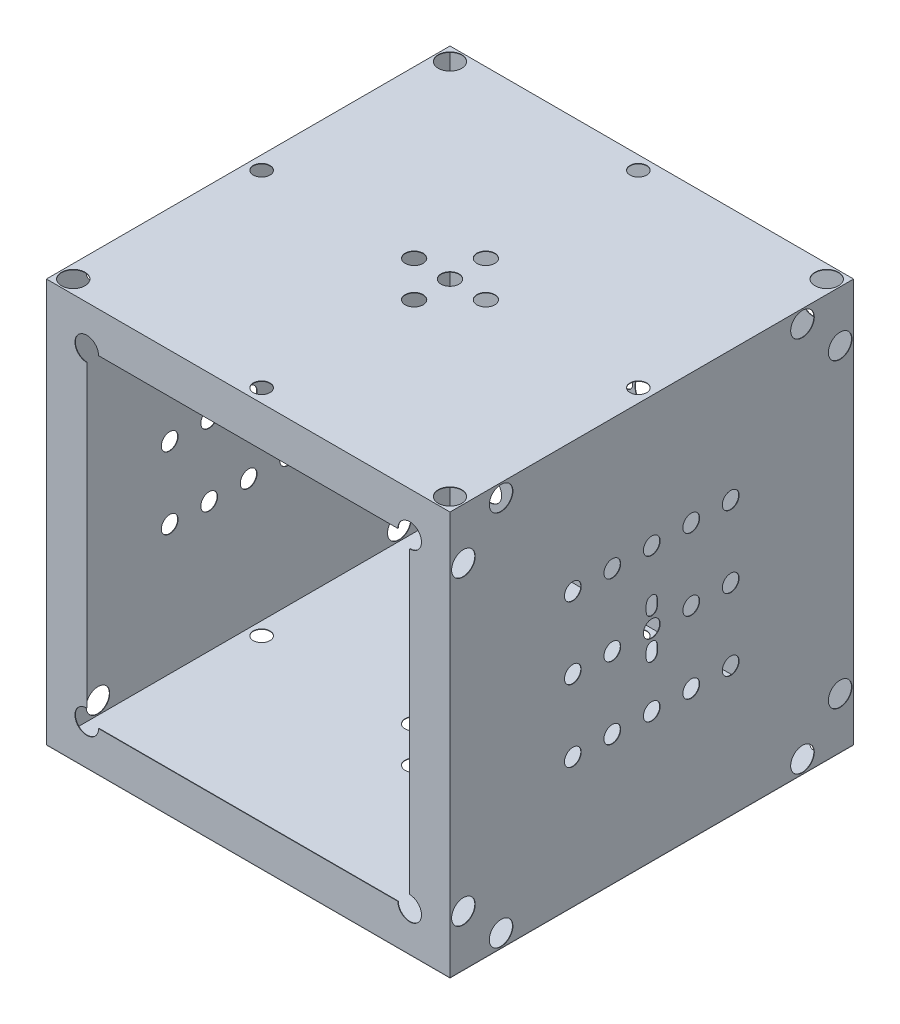
from build123d import *

# Parameters (mm, degrees)
SKETCH1_W           = 2249.6
SKETCH1_H           = 2249.6
BOSS_EXTRUDE1_DEPTH = 2249.6
SHELL1_T            = -2.4
SKETCH2_W           = 2249.6
SKETCH2_H           = 2249.6
SKETCH2_W_2         = 1800
SKETCH2_H_2         = 1800
BOSS_EXTRUDE3_DEPTH = 2.4
SKETCH3_R           = 49.85
SKETCH3_R_2         = 46.75
SKETCH3_R_3         = 65.8
CUT_EXTRUDE1_DEPTH  = 2756.186062683
SKETCH4_R           = 46.75
SKETCH4_R_2         = 65.8
CUT_EXTRUDE2_DEPTH  = 3375.4
SKETCH5_R           = 91.2
SKETCH5_R_2         = 35.635
SKETCH5_R_3         = 65.8
CUT_EXTRUDE3_DEPTH  = 3375.4


with BuildPart() as part:
    # Sketch1 → Boss-Extrude1 (new body)
    with BuildSketch(Plane(origin=(0, 0, 0), x_dir=(1, 0, 0), z_dir=(0, 1, 0))):
        Rectangle(SKETCH1_W, SKETCH1_H)
    extrude(amount=BOSS_EXTRUDE1_DEPTH)

    # Shell1
    shell1_openings = [part.faces().sort_by_distance(p)[0] for p in [
        (0, 1124.8, 1124.8),
    ]]
    offset(amount=SHELL1_T, openings=shell1_openings, kind=Kind.INTERSECTION)

    # Sketch2 → Boss-Extrude3 (add)
    with BuildSketch(Plane.XY.offset(1124.8)):
        with Locations((0, 1124.8)):
            Rectangle(SKETCH2_W, SKETCH2_H)
        with Locations((0, 1124.8)):
            Rectangle(SKETCH2_W_2, SKETCH2_H_2, mode=Mode.SUBTRACT)
    extrude(amount=-BOSS_EXTRUDE3_DEPTH)

    # Sketch3 → Cut-Extrude1 (cut, through all)
    with BuildSketch(Plane(origin=(0, 2249.6, 0), x_dir=(1, 0, 0), z_dir=(0, 1, 0))):
        Circle(SKETCH3_R)
        with Locations((-200, 0)):
            Circle(SKETCH3_R)
        with Locations((-1050, 0)):
            Circle(SKETCH3_R_2)
        with Locations((-1050, 1050)):
            Circle(SKETCH3_R_3)
        with Locations((1050, 1050)):
            Circle(SKETCH3_R_3)
        with Locations((200, 0)):
            Circle(SKETCH3_R)
        with Locations((1050, 0)):
            Circle(SKETCH3_R_2)
        with Locations((-1050, -1050)):
            Circle(SKETCH3_R_3)
        with Locations((0, -1050)):
            Circle(SKETCH3_R_2)
        with Locations((0, -200)):
            Circle(SKETCH3_R)
        with Locations((0, 200)):
            Circle(SKETCH3_R)
        with Locations((0, 1050)):
            Circle(SKETCH3_R_2)
        with Locations((1050, -1050)):
            Circle(SKETCH3_R_3)
    extrude(amount=-CUT_EXTRUDE1_DEPTH, mode=Mode.SUBTRACT)

    # Sketch4 → Cut-Extrude2 (cut, through all)
    with BuildSketch(Plane.ZY.offset(1124.8)):
        with Locations((0, 1124.8)):
            Circle(SKETCH4_R)
        with Locations((-220, 1124.8)):
            Circle(SKETCH4_R)
        with Locations((-440, 1124.8)):
            Circle(SKETCH4_R)
        with Locations((220, 1124.8)):
            Circle(SKETCH4_R)
        with Locations((440, 1124.8)):
            Circle(SKETCH4_R)
        with Locations((-440, 1524.8)):
            Circle(SKETCH4_R)
        with Locations((-220, 1524.8)):
            Circle(SKETCH4_R)
        with Locations((0, 1524.8)):
            Circle(SKETCH4_R)
        with Locations((220, 1524.8)):
            Circle(SKETCH4_R)
        with Locations((440, 1524.8)):
            Circle(SKETCH4_R)
        with Locations((440, 724.8)):
            Circle(SKETCH4_R)
        with Locations((220, 724.8)):
            Circle(SKETCH4_R)
        with Locations((0, 724.8)):
            Circle(SKETCH4_R)
        with Locations((-220, 724.8)):
            Circle(SKETCH4_R)
        with Locations((-440, 724.8)):
            Circle(SKETCH4_R)
        with Locations((-840, 2174.8)):
            Circle(SKETCH4_R_2)
        with Locations((-1050, 1964.8)):
            Circle(SKETCH4_R_2)
        with Locations((1050, 1964.8)):
            Circle(SKETCH4_R_2)
        with Locations((840, 2174.8)):
            Circle(SKETCH4_R_2)
        with Locations((1050, 284.8)):
            Circle(SKETCH4_R_2)
        with Locations((840, 74.8)):
            Circle(SKETCH4_R_2)
        with Locations((-840, 74.8)):
            Circle(SKETCH4_R_2)
        with Locations((-1050, 284.8)):
            Circle(SKETCH4_R_2)
        with BuildLine():
            Line((30.9, 1254.8), (30.9, 1217.3))
            ThreePointArc((30.9, 1217.3), (0, 1186.4), (-30.9, 1217.3))
            Line((-30.9, 1217.3), (-30.9, 1254.8))
            ThreePointArc((-30.9, 1254.8), (0, 1285.7), (30.9, 1254.8))
        make_face()
        with BuildLine():
            Line((30.9, 994.8), (30.9, 1032.3))
            ThreePointArc((30.9, 1032.3), (0, 1063.2), (-30.9, 1032.3))
            Line((-30.9, 1032.3), (-30.9, 994.8))
            ThreePointArc((-30.9, 994.8), (0, 963.9), (30.9, 994.8))
        make_face()
    extrude(amount=-CUT_EXTRUDE2_DEPTH, mode=Mode.SUBTRACT)

    # Sketch5 → Cut-Extrude3 (cut, through all)
    with BuildSketch(Plane(origin=(0, 0, -1124.8), x_dir=(-1, 0, 0), z_dir=(0, 0, -1))):
        with Locations((0, 1124.8)):
            Circle(SKETCH5_R)
        with Locations((0, 1264.8)):
            Circle(SKETCH5_R_2)
        with Locations((0, 984.8)):
            Circle(SKETCH5_R_2)
        with Locations((140, 1124.8)):
            Circle(SKETCH5_R_2)
        with Locations((-140, 1124.8)):
            Circle(SKETCH5_R_2)
        with Locations((-222, 1506.8)):
            Circle(SKETCH5_R)
        with Locations((222, 742.8)):
            Circle(SKETCH5_R)
        with Locations((-900, 2024.8)):
            Circle(SKETCH5_R_3)
        with Locations((900, 2024.8)):
            Circle(SKETCH5_R_3)
        with Locations((900, 224.8)):
            Circle(SKETCH5_R_3)
        with Locations((-900, 224.8)):
            Circle(SKETCH5_R_3)
    extrude(amount=-CUT_EXTRUDE3_DEPTH, mode=Mode.SUBTRACT)


with BuildPart() as body_2:
    # Split1: the piece on the far side of the plane
    add(part.part)
    split(bisect_by=Plane.ZX.offset(2.4), keep=Keep.BOTTOM)


with BuildPart() as part_1:
    add(part.part)

    # Split1
    split(bisect_by=Plane.ZX.offset(2.4), keep=Keep.TOP)


solid = Compound([body_2.part, part_1.part])
